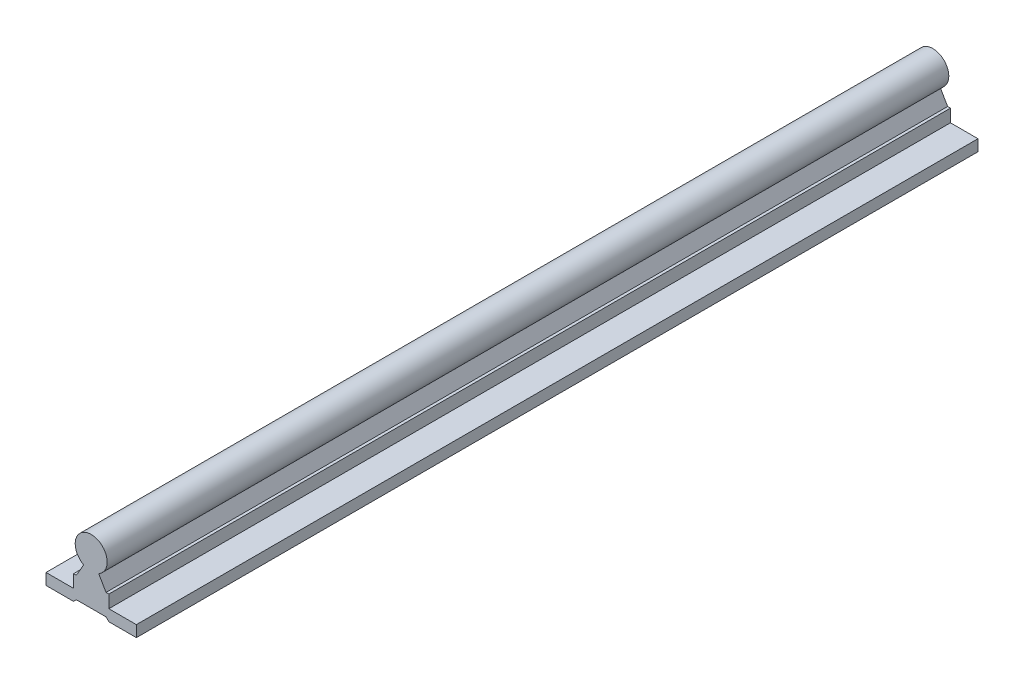
from build123d import *

# Parameters (mm, degrees)
EXTRUDE_1_DEPTH     = 149
SKETCH_2_W          = 10.5
SKETCH_2_H          = 1
CUT_EXTRUDE_1_DEPTH = 300.365635096
CHAMFER_1_SIZE      = 1


with BuildPart() as part:
    # 草图1 → 凸台-拉伸1 (new, symmetric)
    with BuildSketch(Plane.XY):
        with BuildLine():
            Line((-16, 0), (16, 0))
            Line((16, 0), (16, 4))
            Line((16, 4), (6.25, 4))
            Line((6.25, 4), (6.25, 8.5))
            Line((6.25, 8.5), (5.25, 8.5))
            Line((5.25, 8.5), (2.651923789, 13))
            ThreePointArc((2.651923789, 13), (0, 23.659743791), (-2.651923789, 13))
            Line((-2.651923789, 13), (-5.25, 8.5))
            Line((-5.25, 8.5), (-6.25, 8.5))
            Line((-6.25, 8.5), (-6.25, 4))
            Line((-6.25, 4), (-16, 4))
            Line((-16, 4), (-16, 0))
        make_face()
    extrude(amount=EXTRUDE_1_DEPTH, both=True)

    # 草图2 → 切除-拉伸1 (cut, through all)
    with BuildSketch(Plane.XY.offset(149)):
        with Locations((0, 0.5)):
            Rectangle(SKETCH_2_W, SKETCH_2_H)
    extrude(amount=-CUT_EXTRUDE_1_DEPTH, mode=Mode.SUBTRACT)

    # 倒角1
    chamfer_1_edges = [part.edges().sort_by_distance(p)[0] for p in [
        (5.25, 0, 0),
        (-5.25, 0, 0),
    ]]
    chamfer(chamfer_1_edges, length=CHAMFER_1_SIZE - 0.0001)  # a hair under: the kernel refuses the full size


solid = part.part
